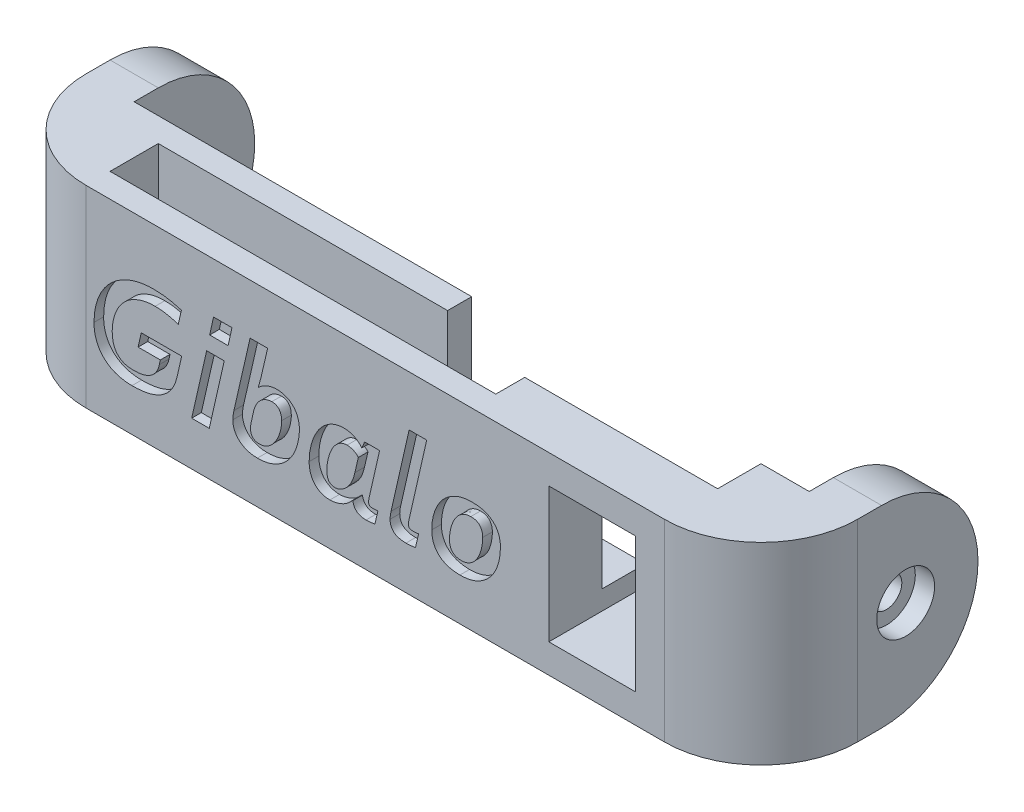
from build123d import *

# Parameters (mm, degrees)
SKETCH1_W           = 70
SKETCH1_H           = 10
BOSS_EXTRUDE1_DEPTH = 20
FILLET1_R           = 10
FILLET2_R           = 10
SKETCH4_R           = 1.6
CUT_EXTRUDE2_DEPTH  = 94
SKETCH5_R           = 3
CUT_EXTRUDE3_DEPTH  = 2
CUT_EXTRUDE4_START  = -2
SKETCH6_R           = 3
CUT_EXTRUDE4_DEPTH  = 2
CUT_EXTRUDE5_DEPTH  = 15
CUT_EXTRUDE7_DEPTH  = 1
SKETCH10_W          = 9
SKETCH10_H          = 14
CUT_EXTRUDE8_DEPTH  = 16


with BuildPart() as part:
    # Sketch1 → Boss-Extrude1 (new body)
    with BuildSketch(Plane(origin=(0, 0, 0), x_dir=(1, 0, 0), z_dir=(0, 1, 0))):
        Polygon((-34.024767802, -4.690402477), (-34.024767802, 5.309597523), (-34.024767802, 17.809597523), (-39.024767802, 17.809597523), (-39.024767802, -4.690402477), align=None)
        with Locations((0.975232198, 0.309597523)):
            Rectangle(SKETCH1_W, SKETCH1_H)
        Polygon((35.975232198, 17.809597523), (35.975232198, 5.309597523), (35.975232198, -4.690402477), (40.975232198, -4.690402477), (40.975232198, 17.809597523), align=None)
    extrude(amount=BOSS_EXTRUDE1_DEPTH)

    # Fillet1
    fillet1_edges = [part.edges().sort_by_distance(p)[0] for p in [
        (40.975232198, 10, 4.690402477),
        (-39.024767802, 10, 4.690402477),
    ]]
    fillet(fillet1_edges, radius=FILLET1_R)

    # Fillet2
    fillet2_edges = [part.edges().sort_by_distance(p)[0] for p in [
        (-36.524767802, 0, -17.809597523),
        (38.475232198, 0, -17.809597523),
        (38.475232198, 20, -17.809597523),
        (-36.524767802, 20, -17.809597523),
    ]]
    fillet(fillet2_edges, radius=FILLET2_R - 0.0001)  # a hair under: the kernel refuses the full size

    # Sketch4 → Cut-Extrude2 (cut)
    with BuildSketch(Plane(origin=(40.975232198, 0, 0), x_dir=(0, 0, -1), z_dir=(1, 0, 0))):
        with Locations((10.309597523, 10)):
            Circle(SKETCH4_R)
    extrude(amount=-CUT_EXTRUDE2_DEPTH, mode=Mode.SUBTRACT)

    # Sketch5 → Cut-Extrude3 (cut)
    with BuildSketch(Plane.ZY.offset(39.024767802)):
        with Locations((-10.309597523, 10)):
            Circle(SKETCH5_R)
    extrude(amount=-CUT_EXTRUDE3_DEPTH, mode=Mode.SUBTRACT)

    # Sketch6 → Cut-Extrude4 (cut)
    with BuildSketch(Plane(origin=(40.975232198, 0, 0), x_dir=(0, 0, -1), z_dir=(1, 0, 0)).offset(CUT_EXTRUDE4_START)):
        with Locations(Location((10.309597523, 10, 0), (0, 0, 180))):
            Circle(SKETCH6_R)
    extrude(amount=CUT_EXTRUDE4_DEPTH, mode=Mode.SUBTRACT)

    # Sketch7 → Cut-Extrude5 (cut)
    with BuildSketch(Plane(origin=(0, 20, 0), x_dir=(1, 0, 0), z_dir=(0, 1, 0))):
        Polygon((0.975232198, 2.809597523), (-29.024767802, 2.809597523), (-29.024767802, -2.190402477), (10.975232198, -2.190402477), (10.975232198, 0.809597523), (30.975232198, 0.809597523), (30.975232198, 5.309597523), (0.975232198, 5.309597523), align=None)
    extrude(amount=-CUT_EXTRUDE5_DEPTH, mode=Mode.SUBTRACT)

    # Sketch9 → Cut-Extrude7 (cut)
    # profile 1 of 7: a face of its own
    with BuildSketch(Plane.XY.offset(4.690402477)):
        with BuildLine():
            add(Edge.make_bspline(
                [(-21.97503532, 14.185374159), (-21.841839767, 14.183870266), (-21.577998515, 14.180891271), (-21.187421598, 14.154039466), (-20.805975821, 14.116646277), (-20.436911935, 14.055726848), (-20.081776238, 13.988084032), (-19.744866959, 13.910604742), (-19.428398913, 13.826075799), (-19.226767867, 13.759660684), (-19.128753729, 13.727375873)],
                knots=[0, 0, 0, 0, 1.103935331, 2.186737251, 3.24413943, 4.27965227, 5.286007376, 6.240597236, 7.144743092, 8, 8, 8, 8], degree=3))
            Line((-19.128753729, 13.727375873), (-19.452907768, 12.301098102))
            add(Edge.make_bspline(
                [(-19.452907768, 12.301098102), (-19.559322482, 12.336037479), (-19.768277926, 12.404644276), (-20.080819621, 12.492565948), (-20.385047736, 12.565649475), (-20.777096315, 12.643448807), (-21.261682763, 12.711620627), (-21.649927348, 12.720976086), (-21.843282388, 12.725635327)],
                knots=[0, 0, 0, 0, 0.826647237, 1.623200706, 2.395726174, 3.135406251, 4.573364156, 6, 6, 6, 6], degree=3))
            add(Edge.make_bspline(
                [(-21.843282388, 12.725635327), (-21.964656905, 12.72383746), (-22.203702309, 12.720296587), (-22.555917706, 12.686012821), (-22.895421629, 12.629648714), (-23.221450977, 12.551910142), (-23.532443943, 12.457494258), (-23.824993512, 12.340324953), (-24.100854584, 12.210576458), (-24.357108439, 12.060403901), (-24.596581258, 11.89658639), (-24.820922416, 11.719118053), (-25.028703119, 11.525543998), (-25.220398616, 11.318939821), (-25.396677952, 11.101054923), (-25.555512265, 10.872899146), (-25.698314811, 10.63515264), (-25.825824306, 10.389400393), (-25.935640205, 10.134836444), (-26.036040326, 9.87560572), (-26.115416325, 9.607679332), (-26.208670588, 9.246280193), (-26.284937966, 8.78590874), (-26.296306929, 8.414349351), (-26.301968907, 8.229305113)],
                knots=[0, 0, 0, 0, 1.125655505, 2.216962681, 3.279004566, 4.315782685, 5.324180779, 6.29084783, 7.23667735, 8.149478511, 9.042714482, 9.926395845, 10.800346389, 11.674296933, 12.538794144, 13.398075675, 14.250909206, 15.109898696, 15.964128529, 16.821656322, 17.686951297, 18.55427363, 20.283957211, 22, 22, 22, 22], degree=3))
            add(Edge.make_bspline(
                [(-26.301968907, 8.229305113), (-26.30073708, 8.133716909), (-26.298348921, 7.94839883), (-26.269353582, 7.680312669), (-26.229216438, 7.42956926), (-26.169164485, 7.196720527), (-26.088834278, 6.983152781), (-25.995128711, 6.785759307), (-25.881646622, 6.607780069), (-25.75153409, 6.446512281), (-25.601017358, 6.306342252), (-25.43599476, 6.181596823), (-25.251813325, 6.078960925), (-25.050881599, 5.995405295), (-24.833427654, 5.927652671), (-24.597505665, 5.883918067), (-24.345342517, 5.852467871), (-24.171026104, 5.850436359), (-24.080990913, 5.849387074)],
                knots=[0, 0, 0, 0, 1.229197895, 2.383061741, 3.465272405, 4.494181844, 5.470381682, 6.396955037, 7.300098202, 8.17973572, 9.05524884, 9.93953742, 10.835033703, 11.759477851, 12.735348058, 13.759006526, 14.842517054, 16, 16, 16, 16], degree=3))
            add(Edge.make_bspline(
                [(-24.080990913, 5.849387074), (-23.997312345, 5.850624955), (-23.832526741, 5.853062676), (-23.589318629, 5.871348131), (-23.355129716, 5.906184688), (-23.128900697, 5.948315537), (-22.913563807, 6.007076274), (-22.709204589, 6.079430654), (-22.519260916, 6.170643261), (-22.339369535, 6.272520043), (-22.173564589, 6.392796511), (-22.019976699, 6.528643372), (-21.882120548, 6.682844085), (-21.755244733, 6.851539824), (-21.641714843, 7.036885961), (-21.548485139, 7.242692558), (-21.467343317, 7.463765412), (-21.431026142, 7.620251332), (-21.412471214, 7.70020207)],
                knots=[0, 0, 0, 0, 1.127770514, 2.22088344, 3.28382356, 4.317503795, 5.320323511, 6.289163694, 7.234766033, 8.156544892, 9.071788957, 9.990114012, 10.914713456, 11.854228665, 12.832272572, 13.836895091, 14.894840947, 16, 16, 16, 16], degree=3))
            Line((-21.412471214, 7.70020207), (-21.312088028, 8.172839571))
            Line((-21.312088028, 8.172839571), (-23.616718677, 8.172839571))
            Line((-23.616718677, 8.172839571), (-23.292564639, 9.620030505))
            Line((-23.292564639, 9.620030505), (-19.097383983, 9.620030505))
            Line((-19.097383983, 9.620030505), (-19.576295434, 7.507800963))
            add(Edge.make_bspline(
                [(-19.576295434, 7.507800963), (-19.613362772, 7.362016884), (-19.685291254, 7.079125581), (-19.834035213, 6.679791854), (-20.014363107, 6.319382601), (-20.224462976, 5.997247317), (-20.461544627, 5.711777003), (-20.716720754, 5.454000112), (-20.997075111, 5.229938201), (-21.297346637, 5.034008778), (-21.618061502, 4.870133676), (-21.955206154, 4.730980062), (-22.309306528, 4.618337785), (-22.679448489, 4.531576206), (-23.061009659, 4.467139688), (-23.452237995, 4.425323698), (-23.851109481, 4.393023974), (-24.120657305, 4.390780313), (-24.256661489, 4.389648242)],
                knots=[0, 0, 0, 0, 1.171066271, 2.272432405, 3.311764285, 4.304254046, 5.260908622, 6.197756602, 7.124638, 8.050882979, 8.985872289, 9.925673948, 10.88903917, 11.876824032, 12.88465781, 13.901041654, 14.940940747, 16, 16, 16, 16], degree=3))
            add(Edge.make_bspline(
                [(-24.256661489, 4.389648242), (-24.396926001, 4.392110002), (-24.67266241, 4.396949406), (-25.0765234, 4.445394133), (-25.464458471, 4.517136018), (-25.833456334, 4.621255534), (-26.182350176, 4.755184079), (-26.508021178, 4.918177451), (-26.808306182, 5.111650304), (-27.084262773, 5.332504256), (-27.334845354, 5.581063197), (-27.552512552, 5.862485087), (-27.743799283, 6.169030922), (-27.906142343, 6.503459098), (-28.03340289, 6.866914483), (-28.124986723, 7.257283212), (-28.179846485, 7.674247199), (-28.186835403, 7.960750539), (-28.190427597, 8.108008763)],
                knots=[0, 0, 0, 0, 1.099310515, 2.161059335, 3.184816847, 4.190140034, 5.162577533, 6.111016273, 7.040427035, 7.958078671, 8.877941518, 9.800771385, 10.741111504, 11.706735398, 12.709395315, 13.754110347, 14.845647931, 16, 16, 16, 16], degree=3))
            add(Edge.make_bspline(
                [(-28.190427597, 8.108008763), (-28.187886608, 8.246806946), (-28.182834681, 8.522761797), (-28.146296127, 8.932676385), (-28.08783138, 9.334856404), (-28.007262112, 9.728561914), (-27.89951883, 10.110710914), (-27.772738283, 10.482214726), (-27.621550702, 10.839480997), (-27.450673105, 11.184160789), (-27.254098247, 11.5120534), (-27.042460543, 11.829550733), (-26.804245286, 12.128559487), (-26.547221344, 12.413571282), (-26.269567043, 12.681101635), (-25.97095455, 12.929029823), (-25.653335285, 13.156304657), (-25.317558354, 13.36436389), (-24.962572576, 13.550889344), (-24.589191949, 13.71633122), (-24.195647471, 13.855631533), (-23.785579739, 13.975777712), (-23.356613781, 14.06994447), (-22.910704134, 14.135166606), (-22.448575664, 14.179738151), (-22.134781515, 14.183472884), (-21.97503532, 14.185374159)],
                knots=[0, 0, 0, 0, 1.023740072, 2.035372753, 3.03309641, 4.020390265, 4.997251231, 5.959934282, 6.913995603, 7.856835973, 8.79515039, 9.732153554, 10.669340121, 11.612250598, 12.561421687, 13.510801681, 14.472591674, 15.440082999, 16.422234839, 17.428324357, 18.449750217, 19.499353084, 20.578578765, 21.68613438, 22.822058251, 24, 24, 24, 24], degree=3))
        make_face()
    # profile 2 of 7: a face of its own
    with BuildSketch(Plane.XY.offset(4.690402477)):
        Polygon((-16.19463685, 12.97241066), (-15.793104105, 14.78558196), (-13.881640935, 14.78558196), (-14.28317368, 12.97241066), align=None)
    # profile 3 of 7: a face of its own
    with BuildSketch(Plane.XY.offset(4.690402477)):
        Polygon((-18.062182376, 4.565318818), (-16.504151674, 11.403923376), (-14.682615108, 11.403923376), (-16.24064581, 4.565318818), align=None)
    # profile 4 of 7: a face of its own
    with BuildSketch(Plane.XY.offset(4.690402477)):
        with BuildLine():
            add(Edge.make_bspline(
                [(-10.872236666, 11.822186652), (-10.917790136, 11.644106317), (-11.006157743, 11.298654411), (-11.107537275, 10.956797481), (-11.156655694, 10.791167677)],
                knots=[0, 0, 0, 0, 1.030999291, 2, 2, 2, 2], degree=3))
            Line((-11.156655694, 10.791167677), (-11.125285948, 10.791167677))
            add(Edge.make_bspline(
                [(-11.125285948, 10.791167677), (-11.075443232, 10.841135174), (-10.972566058, 10.9442699), (-10.791444979, 11.08166194), (-10.588346037, 11.212365998), (-10.361132912, 11.332560056), (-10.110592494, 11.435801784), (-9.834849332, 11.512136629), (-9.538534491, 11.564532845), (-9.333261179, 11.570350094), (-9.228461993, 11.573320003)],
                knots=[0, 0, 0, 0, 0.80320757, 1.657849576, 2.583078345, 3.552904099, 4.582291314, 5.663349111, 6.807058219, 8, 8, 8, 8], degree=3))
            add(Edge.make_bspline(
                [(-9.228461993, 11.573320003), (-9.149638954, 11.57093035), (-8.994319071, 11.566221566), (-8.763452827, 11.54015028), (-8.540448662, 11.487727061), (-8.322192007, 11.423179955), (-8.115960401, 11.333755895), (-7.919631699, 11.231122848), (-7.740995325, 11.102964096), (-7.575120272, 10.958601646), (-7.423533188, 10.795605599), (-7.291764424, 10.610987164), (-7.173998516, 10.409753738), (-7.073609936, 10.189162843), (-6.991456969, 9.950040429), (-6.932972311, 9.691427327), (-6.900293077, 9.413829082), (-6.895123402, 9.222765089), (-6.892461598, 9.124388523)],
                knots=[0, 0, 0, 0, 0.992034587, 1.954792649, 2.91655148, 3.870883492, 4.814067566, 5.740132838, 6.652642756, 7.572582667, 8.503577047, 9.445659485, 10.420407327, 11.432971191, 12.489696427, 13.596064595, 14.762242398, 16, 16, 16, 16], degree=3))
            add(Edge.make_bspline(
                [(-6.892461598, 9.124388523), (-6.897588474, 8.947680804), (-6.908062146, 8.586685378), (-6.99902938, 8.043538321), (-7.136247956, 7.496175208), (-7.302133921, 7.049296636), (-7.4623203, 6.702115836), (-7.599719711, 6.448414674), (-7.753691432, 6.203461022), (-7.923296288, 5.966047375), (-8.108902398, 5.740830329), (-8.310153044, 5.528292997), (-8.529095221, 5.331430744), (-8.7626028, 5.147645867), (-9.012352547, 4.978420652), (-9.281442478, 4.831025652), (-9.565708234, 4.698268903), (-9.867753495, 4.587228672), (-10.187468927, 4.499500755), (-10.524943382, 4.434113703), (-10.881145189, 4.396682867), (-11.124502301, 4.392024925), (-11.248673614, 4.389648242)],
                knots=[0, 0, 0, 0, 1.472759177, 3.008693273, 4.580848206, 6.173729551, 6.974835018, 7.768225139, 8.577953803, 9.386220295, 10.199800618, 11.009883982, 11.824854739, 12.65290799, 13.486513861, 14.337454105, 15.208802548, 16.100850079, 17.017617301, 17.970785264, 18.964606969, 20, 20, 20, 20], degree=3))
            add(Edge.make_bspline(
                [(-11.248673614, 4.389648242), (-11.346346162, 4.391594861), (-11.536643607, 4.395387498), (-11.814658287, 4.426676924), (-12.075385793, 4.481242748), (-12.319968631, 4.553992644), (-12.545770852, 4.647185484), (-12.75652946, 4.75240767), (-12.946630265, 4.87770862), (-13.122009676, 5.012133039), (-13.27534678, 5.165321884), (-13.412727198, 5.329914819), (-13.527319375, 5.511477183), (-13.62412369, 5.703833126), (-13.698931883, 5.90681218), (-13.753505507, 6.117608386), (-13.788348605, 6.334807231), (-13.791981509, 6.482229146), (-13.793805647, 6.55625201)],
                knots=[0, 0, 0, 0, 1.250491143, 2.436357748, 3.576037707, 4.657605152, 5.698591998, 6.700616389, 7.668707818, 8.609754101, 9.525002799, 10.438203324, 11.349438519, 12.267599054, 13.191167577, 14.113484272, 15.052750757, 16, 16, 16, 16], degree=3))
            add(Edge.make_bspline(
                [(-13.793805647, 6.55625201), (-13.792370184, 6.618322881), (-13.789462175, 6.744068085), (-13.775405614, 6.904555811), (-13.755966959, 7.04313326), (-13.734341885, 7.1635187), (-13.709976085, 7.299742313), (-13.689544085, 7.39492958), (-13.678783246, 7.445061471)],
                knots=[0, 0, 0, 0, 1.244333274, 2.520811148, 3.226291687, 4.048702975, 4.972318327, 6, 6, 6, 6], degree=3))
            Line((-13.678783246, 7.445061471), (-12.005730143, 14.78558196))
            Line((-12.005730143, 14.78558196), (-10.184193578, 14.78558196))
            Line((-10.184193578, 14.78558196), (-10.872236666, 11.822186652))
        make_face()
        with BuildLine():
            add(Edge.make_bspline(
                [(-11.896981692, 7.240112466), (-11.910151005, 7.177496375), (-11.933040244, 7.06866498), (-11.955939824, 6.922769197), (-11.964892236, 6.806644696), (-11.965640435, 6.737510031), (-11.965995132, 6.704735473)],
                knots=[0, 0, 0, 0, 1.419193461, 2.466663119, 3.273093488, 4, 4, 4, 4], degree=3))
            add(Edge.make_bspline(
                [(-11.965995132, 6.704735473), (-11.963320417, 6.636187152), (-11.958215466, 6.50535611), (-11.915762954, 6.318845009), (-11.844574396, 6.153972407), (-11.745500922, 6.010364543), (-11.615819868, 5.894615464), (-11.454954558, 5.814203272), (-11.268142433, 5.766210874), (-11.134650917, 5.760411033), (-11.064637773, 5.757369154)],
                knots=[0, 0, 0, 0, 1.106449162, 2.111764306, 3.069993933, 3.991658481, 4.909116541, 5.845930511, 6.87024148, 8, 8, 8, 8], degree=3))
            add(Edge.make_bspline(
                [(-11.064637773, 5.757369154), (-11.002450729, 5.758511051), (-10.88013206, 5.760757102), (-10.701708119, 5.792343274), (-10.530735673, 5.83710977), (-10.315494803, 5.925624572), (-10.061488387, 6.072050895), (-9.789094428, 6.302073628), (-9.543454746, 6.573334725), (-9.330453192, 6.88309249), (-9.147386961, 7.218680925), (-8.997429876, 7.573051693), (-8.878556218, 7.936980957), (-8.793925695, 8.303769066), (-8.738839958, 8.661942447), (-8.73195952, 8.897649135), (-8.728637378, 9.011457439)],
                knots=[0, 0, 0, 0, 0.593425366, 1.167236712, 1.726322451, 2.279223644, 3.386329273, 4.512093459, 5.672136548, 6.873201344, 8.095358979, 9.318967893, 10.544913375, 11.748634989, 12.912953905, 14, 14, 14, 14], degree=3))
            add(Edge.make_bspline(
                [(-8.728637378, 9.011457439), (-8.731274915, 9.089772992), (-8.736452252, 9.243502039), (-8.782058153, 9.464899533), (-8.850283048, 9.670552115), (-8.9564154, 9.851173319), (-9.096672469, 10.005484159), (-9.246925237, 10.098811418), (-9.383055778, 10.154263977), (-9.497318914, 10.185817359), (-9.622582401, 10.201623978), (-9.708729953, 10.204242069), (-9.753382404, 10.205599091)],
                knots=[0, 0, 0, 0, 1.315784066, 2.582810458, 3.787998383, 4.944283209, 6.080901484, 7.261658167, 7.882207875, 8.550646753, 9.248763636, 10, 10, 10, 10], degree=3))
            add(Edge.make_bspline(
                [(-9.753382404, 10.205599091), (-9.841680608, 10.200319859), (-10.026775064, 10.189253308), (-10.25512524, 10.123234434), (-10.44109555, 10.050959481), (-10.580622961, 9.97882149), (-10.715940213, 9.890636071), (-10.848132083, 9.788481101), (-10.972974683, 9.66988259), (-11.096028428, 9.540391817), (-11.209987493, 9.393077095), (-11.319355048, 9.232742006), (-11.418234509, 9.055135122), (-11.506579048, 8.86056691), (-11.579203501, 8.646555698), (-11.616447564, 8.496597378), (-11.635567144, 8.419614904)],
                knots=[0, 0, 0, 0, 1.323624627, 2.774638316, 3.539762985, 4.316167742, 5.125469977, 5.960117866, 6.818408992, 7.706261799, 8.637226509, 9.608886798, 10.615485335, 11.682625625, 12.810354677, 14, 14, 14, 14], degree=3))
            Line((-11.635567144, 8.419614904), (-11.896981692, 7.240112466))
        make_face(mode=Mode.SUBTRACT)
    # profile 5 of 7: a face of its own
    with BuildSketch(Plane.XY.offset(4.690402477)):
        with BuildLine():
            add(Edge.make_bspline(
                [(0.282844897, 6.209093492), (0.283753374, 6.179698008), (0.285467977, 6.124218839), (0.305894446, 6.047052206), (0.342802631, 5.984189828), (0.410807304, 5.915412535), (0.539192525, 5.868425023), (0.647886746, 5.861527694), (0.707382122, 5.85775234)],
                knots=[0, 0, 0, 0, 0.836637905, 1.579017247, 2.246934084, 2.893221951, 4.299459483, 6, 6, 6, 6], degree=3))
            add(Edge.make_bspline(
                [(0.707382122, 5.85775234), (0.790425491, 5.860047116), (0.973026122, 5.865093005), (1.154352941, 5.887410664), (1.253215697, 5.899578668)],
                knots=[0, 0, 0, 0, 0.909562782, 2, 2, 2, 2], degree=3))
            Line((1.253215697, 5.899578668), (0.937426923, 4.559044869))
            add(Edge.make_bspline(
                [(0.937426923, 4.559044869), (0.781654439, 4.532211309), (0.477771267, 4.479864021), (0.169559466, 4.471233438), (0.019339033, 4.467026948)],
                knots=[0, 0, 0, 0, 1.025212973, 2, 2, 2, 2], degree=3))
            add(Edge.make_bspline(
                [(0.019339033, 4.467026948), (-0.079941988, 4.469560888), (-0.267523541, 4.474348514), (-0.529103849, 4.527352105), (-0.75551244, 4.609647376), (-0.943722508, 4.731031124), (-1.094821821, 4.885546987), (-1.21376598, 5.067673995), (-1.30309901, 5.278092271), (-1.335646007, 5.431072166), (-1.352564511, 5.510593821)],
                knots=[0, 0, 0, 0, 1.246503269, 2.355143187, 3.339908273, 4.258822686, 5.145057094, 6.037165818, 6.979684067, 8, 8, 8, 8], degree=3))
            Line((-1.352564511, 5.510593821), (-1.383934257, 5.510593821))
            add(Edge.make_bspline(
                [(-1.383934257, 5.510593821), (-1.471849684, 5.415806422), (-1.643299828, 5.230954757), (-1.92767224, 4.995133849), (-2.219516688, 4.797487447), (-2.521584579, 4.64436316), (-2.827681102, 4.533457119), (-3.130131695, 4.449833267), (-3.430395557, 4.400258469), (-3.629837668, 4.393155095), (-3.728299917, 4.389648242)],
                knots=[0, 0, 0, 0, 1.157170378, 2.256680472, 3.301176131, 4.309474979, 5.28167368, 6.213411489, 7.117982044, 8, 8, 8, 8], degree=3))
            add(Edge.make_bspline(
                [(-3.728299917, 4.389648242), (-3.809954589, 4.391586323), (-3.969018433, 4.395361716), (-4.201940095, 4.426897015), (-4.421388161, 4.482150236), (-4.629755013, 4.554099916), (-4.822382712, 4.649423462), (-5.001179921, 4.760569727), (-5.165866562, 4.888216469), (-5.312601892, 5.035694951), (-5.4428718, 5.200420639), (-5.557890848, 5.38041229), (-5.657005605, 5.576478828), (-5.737662911, 5.788362142), (-5.803462955, 6.013279147), (-5.845055066, 6.252594677), (-5.877013286, 6.50241756), (-5.879168326, 6.673951524), (-5.880264471, 6.761201016)],
                knots=[0, 0, 0, 0, 1.08352716, 2.110718132, 3.111568652, 4.083122159, 5.030721548, 5.957540227, 6.87372175, 7.789669641, 8.711579828, 9.656102588, 10.620226043, 11.621974283, 12.661591404, 13.725021968, 14.842849126, 16, 16, 16, 16], degree=3))
            add(Edge.make_bspline(
                [(-5.880264471, 6.761201016), (-5.874595344, 6.952449924), (-5.8631711, 7.337848674), (-5.783872379, 7.912640356), (-5.656131086, 8.47816497), (-5.473684303, 9.023164346), (-5.241602092, 9.540396014), (-5.007997641, 9.945926894), (-4.796196275, 10.248274524), (-4.624907696, 10.459264456), (-4.441920672, 10.655042557), (-4.24748187, 10.835364181), (-4.040651303, 10.99860115), (-3.821437672, 11.143520776), (-3.592148093, 11.271828458), (-3.349470457, 11.378105757), (-3.098079265, 11.467788273), (-2.833266717, 11.527076767), (-2.559053228, 11.566554863), (-2.371875697, 11.571043206), (-2.27692635, 11.573320003)],
                knots=[0, 0, 0, 0, 1.549684503, 3.122875191, 4.693426295, 6.242327983, 7.772165508, 9.28085894, 10.026925728, 10.761894363, 11.481348501, 12.196955084, 12.908984731, 13.614077688, 14.324671518, 15.035377625, 15.758967672, 16.483901761, 17.230930457, 18, 18, 18, 18], degree=3))
            add(Edge.make_bspline(
                [(-2.27692635, 11.573320003), (-2.189673875, 11.5708386), (-2.015750279, 11.565892329), (-1.758792058, 11.528329812), (-1.509211146, 11.461609017), (-1.266586297, 11.372774583), (-1.034267127, 11.256030448), (-0.81601256, 11.109922655), (-0.613659127, 10.933288377), (-0.494937959, 10.796168268), (-0.434476621, 10.726336869)],
                knots=[0, 0, 0, 0, 0.997741803, 1.988835756, 2.961544552, 3.947881021, 4.939103237, 5.927531961, 6.944550552, 8, 8, 8, 8], degree=3))
            Line((-0.434476621, 10.726336869), (-0.403106875, 10.726336869))
            Line((-0.403106875, 10.726336869), (-0.133327062, 11.403923376))
            Line((-0.133327062, 11.403923376), (1.42470364, 11.403923376))
            Line((1.42470364, 11.403923376), (0.343493072, 6.639904666))
            add(Edge.make_bspline(
                [(0.343493072, 6.639904666), (0.335076918, 6.596699558), (0.318816991, 6.513227711), (0.29679275, 6.395815414), (0.286850771, 6.294997304), (0.284048129, 6.234896162), (0.282844897, 6.209093492)],
                knots=[0, 0, 0, 0, 1.212599506, 2.342730416, 3.288499711, 4, 4, 4, 4], degree=3))
        make_face()
        with BuildLine():
            add(Edge.make_bspline(
                [(-0.78163514, 9.676496047), (-0.807421184, 9.707827067), (-0.862714706, 9.775010789), (-0.965366535, 9.866762659), (-1.08578724, 9.957203766), (-1.226918058, 10.03687147), (-1.386438864, 10.101940768), (-1.558836221, 10.159403358), (-1.747455256, 10.199397092), (-1.87866551, 10.203485482), (-1.946498363, 10.205599091)],
                knots=[0, 0, 0, 0, 0.736359573, 1.578990301, 2.493472908, 3.469066101, 4.513512228, 5.618995236, 6.769072233, 8, 8, 8, 8], degree=3))
            add(Edge.make_bspline(
                [(-1.946498363, 10.205599091), (-2.005873255, 10.203522557), (-2.121881745, 10.199465361), (-2.292075485, 10.16948194), (-2.453472191, 10.11903069), (-2.606868946, 10.049446154), (-2.751738942, 9.962471695), (-2.889474773, 9.862223819), (-3.019644789, 9.74884993), (-3.182196403, 9.579821461), (-3.366408923, 9.339595421), (-3.549260432, 9.016006433), (-3.701226111, 8.667508528), (-3.829098834, 8.308531035), (-3.923749461, 7.944827064), (-3.992938957, 7.588636879), (-4.033441429, 7.248005205), (-4.040645409, 7.027586003), (-4.04408869, 6.922232377)],
                knots=[0, 0, 0, 0, 0.667396305, 1.303979425, 1.936156066, 2.564091009, 3.193198933, 3.832862932, 4.477311322, 5.131411362, 6.467147199, 7.868098498, 9.299825973, 10.737655272, 12.148352057, 13.521106702, 14.81516494, 16, 16, 16, 16], degree=3))
            add(Edge.make_bspline(
                [(-4.04408869, 6.922232377), (-4.042353934, 6.828618963), (-4.039111721, 6.653658057), (-3.998625515, 6.411458216), (-3.939142744, 6.206082801), (-3.848122857, 6.039818199), (-3.730118032, 5.911628841), (-3.587028226, 5.821874438), (-3.421587235, 5.764532289), (-3.302865641, 5.759822498), (-3.241023201, 5.757369154)],
                knots=[0, 0, 0, 0, 1.397252255, 2.611426183, 3.65913237, 4.577822536, 5.418040818, 6.232952999, 7.07953983, 8, 8, 8, 8], degree=3))
            add(Edge.make_bspline(
                [(-3.241023201, 5.757369154), (-3.175217489, 5.7600539), (-3.042014424, 5.765488327), (-2.843755489, 5.815004458), (-2.64522972, 5.890565691), (-2.449769424, 5.997879649), (-2.260074319, 6.132418975), (-2.078513569, 6.289053271), (-1.90710898, 6.468048007), (-1.805809004, 6.601207603), (-1.754097256, 6.669183095)],
                knots=[0, 0, 0, 0, 0.872401808, 1.76590436, 2.697517127, 3.687309041, 4.71697306, 5.780077864, 6.866771136, 8, 8, 8, 8], degree=3))
            add(Edge.make_bspline(
                [(-1.754097256, 6.669183095), (-1.686561815, 6.767977237), (-1.547663554, 6.9711644), (-1.384722494, 7.319166913), (-1.242672659, 7.709614845), (-1.173476468, 7.99008352), (-1.137158924, 8.137287193)],
                knots=[0, 0, 0, 0, 0.894383925, 1.839454525, 2.866040106, 4, 4, 4, 4], degree=3))
            Line((-1.137158924, 8.137287193), (-0.78163514, 9.676496047))
        make_face(mode=Mode.SUBTRACT)
    # profile 6 of 7: a face of its own
    with BuildSketch(Plane.XY.offset(4.690402477)):
        with BuildLine():
            Line((4.488482134, 14.78558196), (6.307927384, 14.78558196))
            Line((6.307927384, 14.78558196), (4.465477654, 6.675457044))
            add(Edge.make_bspline(
                [(4.465477654, 6.675457044), (4.456015102, 6.631612055), (4.438644637, 6.551125533), (4.420197029, 6.438679034), (4.406042633, 6.346069088), (4.403741043, 6.28999319), (4.402738163, 6.265559034)],
                knots=[0, 0, 0, 0, 1.295997848, 2.379071419, 3.293706875, 4, 4, 4, 4], degree=3))
            add(Edge.make_bspline(
                [(4.402738163, 6.265559034), (4.404002727, 6.234630161), (4.406380612, 6.17647154), (4.433038235, 6.096767442), (4.47253705, 6.028008907), (4.534528366, 5.977709528), (4.610849948, 5.939058177), (4.702603953, 5.91379869), (4.809903982, 5.896476269), (4.88644427, 5.894414766), (4.927658574, 5.893304718)],
                knots=[0, 0, 0, 0, 1.006221832, 1.892098561, 2.720173339, 3.560065027, 4.45641898, 5.501331371, 6.654553161, 8, 8, 8, 8], degree=3))
            add(Edge.make_bspline(
                [(4.927658574, 5.893304718), (5.017798057, 5.89609918), (5.201778873, 5.901802866), (5.383099161, 5.933568081), (5.475583465, 5.949770261)],
                knots=[0, 0, 0, 0, 0.979879146, 2, 2, 2, 2], degree=3))
            Line((5.475583465, 5.949770261), (5.143064161, 4.550679603))
            add(Edge.make_bspline(
                [(5.143064161, 4.550679603), (5.07622287, 4.538992611), (4.925643875, 4.512664339), (4.683555851, 4.483627371), (4.421232451, 4.462017322), (4.243143076, 4.459764506), (4.15596283, 4.458661683)],
                knots=[0, 0, 0, 0, 0.820141219, 1.847601066, 2.946334286, 4, 4, 4, 4], degree=3))
            add(Edge.make_bspline(
                [(4.15596283, 4.458661683), (4.090428135, 4.460256221), (3.962684683, 4.463364374), (3.777200461, 4.476107313), (3.604493361, 4.505326709), (3.443272462, 4.537988124), (3.29617257, 4.588633123), (3.158994601, 4.642299028), (3.037687098, 4.714049296), (2.924738146, 4.789467525), (2.829163683, 4.881194874), (2.74388007, 4.979918699), (2.672651129, 5.089828729), (2.613579686, 5.208919408), (2.570507136, 5.338821282), (2.535931422, 5.476964768), (2.517891737, 5.625836976), (2.515502527, 5.728050042), (2.514279473, 5.780373634)],
                knots=[0, 0, 0, 0, 1.308481378, 2.550556285, 3.705664751, 4.802759121, 5.827888189, 6.807145062, 7.735566105, 8.634862485, 9.510935339, 10.369601036, 11.233996103, 12.117549373, 13.015122136, 13.959973027, 14.955695742, 16, 16, 16, 16], degree=3))
            add(Edge.make_bspline(
                [(2.514279473, 5.780373634), (2.515562038, 5.838977201), (2.51820957, 5.959949546), (2.538320083, 6.146364819), (2.569611983, 6.343937777), (2.599295253, 6.478316944), (2.614662659, 6.547886745)],
                knots=[0, 0, 0, 0, 0.906536012, 1.871315922, 2.897953231, 4, 4, 4, 4], degree=3))
            Line((2.614662659, 6.547886745), (4.488482134, 14.78558196))
        make_face()
    # profile 7 of 7: a face of its own
    with BuildSketch(Plane.XY.offset(4.690402477)):
        with BuildLine():
            add(Edge.make_bspline(
                [(11.038485032, 11.573320003), (11.146588251, 11.571148315), (11.357625538, 11.566908782), (11.666241564, 11.538662954), (11.958135804, 11.48531077), (12.234440106, 11.41473026), (12.494290754, 11.326109589), (12.73474239, 11.214611802), (12.954940633, 11.082019936), (13.157727074, 10.931699442), (13.337656904, 10.758644499), (13.500132071, 10.567203923), (13.634210386, 10.349983528), (13.750549757, 10.114528104), (13.842991644, 9.858761864), (13.906655712, 9.582113005), (13.947779531, 9.285959213), (13.951740087, 9.081312898), (13.953780064, 8.97590506)],
                knots=[0, 0, 0, 0, 1.169669153, 2.283408447, 3.348613956, 4.376697366, 5.366583206, 6.31478931, 7.23834747, 8.143426999, 9.039663949, 9.933899268, 10.852516597, 11.793616776, 12.77179613, 13.787129265, 14.860209527, 16, 16, 16, 16], degree=3))
            add(Edge.make_bspline(
                [(13.953780064, 8.97590506), (13.950568653, 8.826594113), (13.944202457, 8.530604952), (13.893081147, 8.091147543), (13.805990248, 7.661702727), (13.690946644, 7.242632947), (13.540636363, 6.840457768), (13.35626842, 6.461052742), (13.139649327, 6.104971061), (12.891024195, 5.774391694), (12.610570792, 5.471471706), (12.295268894, 5.202131508), (11.949179606, 4.962409961), (11.570140393, 4.757804173), (11.160444238, 4.589744155), (10.717312228, 4.474713699), (10.244152613, 4.401229576), (9.917826102, 4.393577916), (9.750234143, 4.389648242)],
                knots=[0, 0, 0, 0, 1.026074801, 2.034057279, 3.03574541, 4.035495028, 5.0179998, 5.982309011, 6.930593797, 7.878333713, 8.820814675, 9.761991553, 10.7229142, 11.709115572, 12.717200535, 13.758554929, 14.848857946, 16, 16, 16, 16], degree=3))
            add(Edge.make_bspline(
                [(9.750234143, 4.389648242), (9.643511092, 4.391749819), (9.434535195, 4.395864945), (9.127650021, 4.425392693), (8.835239165, 4.474798095), (8.558031012, 4.545693893), (8.29842877, 4.637625601), (8.056793187, 4.748676411), (7.83341998, 4.877881401), (7.631424441, 5.02961718), (7.449820621, 5.201360783), (7.293278238, 5.396543435), (7.152614855, 5.608482479), (7.038601607, 5.844550026), (6.945621985, 6.099943114), (6.881871818, 6.377361635), (6.840972816, 6.674927516), (6.836990134, 6.880959647), (6.834939111, 6.987063184)],
                knots=[0, 0, 0, 0, 1.154380546, 2.260408698, 3.331541505, 4.35943624, 5.351636664, 6.30651211, 7.232545098, 8.137458525, 9.033530996, 9.928619277, 10.838452366, 11.779379832, 12.757379669, 13.772526469, 14.852883666, 16, 16, 16, 16], degree=3))
            add(Edge.make_bspline(
                [(6.834939111, 6.987063184), (6.838148078, 7.136374551), (6.84450943, 7.432364542), (6.895666505, 7.871815822), (6.982489563, 8.30062512), (7.098024048, 8.719844079), (7.250175103, 9.121543954), (7.434411664, 9.501979766), (7.650789183, 9.857060033), (7.89815833, 10.18738233), (8.179042453, 10.489849087), (8.49398354, 10.760671352), (8.842013553, 10.997445014), (9.218818719, 11.20393436), (9.629290736, 11.370806061), (10.071833598, 11.488420587), (10.545280647, 11.561743012), (10.870901358, 11.56938631), (11.038485032, 11.573320003)],
                knots=[0, 0, 0, 0, 1.026343489, 2.034589917, 3.03654035, 4.031935777, 5.020872116, 5.985433841, 6.933966944, 7.875243875, 8.817971635, 9.766153544, 10.724611634, 11.706859358, 12.715208299, 13.762706599, 14.848556508, 16, 16, 16, 16], degree=3))
        make_face()
        with BuildLine():
            add(Edge.make_bspline(
                [(10.88372762, 10.205599091), (10.823006107, 10.203993162), (10.703814325, 10.200840843), (10.528883076, 10.175976715), (10.362748803, 10.13063342), (10.151645401, 10.053575109), (9.904549323, 9.91871715), (9.641862451, 9.704148982), (9.411464886, 9.446476386), (9.213147741, 9.153039753), (9.049730518, 8.828696176), (8.912405726, 8.484938901), (8.803363131, 8.125350746), (8.72771113, 7.757754771), (8.679303318, 7.389189024), (8.673827601, 7.144056132), (8.671114891, 7.022615563)],
                knots=[0, 0, 0, 0, 0.594782995, 1.167514481, 1.725771235, 2.278908185, 3.366816593, 4.464328711, 5.586176444, 6.741632674, 7.923666515, 9.137317155, 10.364477529, 11.599404698, 12.810728106, 14, 14, 14, 14], degree=3))
            add(Edge.make_bspline(
                [(8.671114891, 7.022615563), (8.674243914, 6.929546269), (8.680214309, 6.751963495), (8.738434943, 6.501127039), (8.829024022, 6.279361264), (8.961485331, 6.090458437), (9.134705803, 5.935812398), (9.356403806, 5.832867092), (9.616708806, 5.766276149), (9.804827776, 5.760463887), (9.904991555, 5.757369154)],
                knots=[0, 0, 0, 0, 1.104585046, 2.107626126, 3.043343293, 3.935332683, 4.827860738, 5.769138119, 6.812179568, 8, 8, 8, 8], degree=3))
            add(Edge.make_bspline(
                [(9.904991555, 5.757369154), (9.96573192, 5.758904717), (10.084960709, 5.761918912), (10.259450927, 5.787755466), (10.425765181, 5.829213207), (10.636211838, 5.908730561), (10.883456852, 6.043588205), (11.146821195, 6.2594786), (11.379106116, 6.515349441), (11.577293823, 6.809383096), (11.74636142, 7.130611493), (11.881010897, 7.476449017), (11.985086489, 7.838043571), (12.058233094, 8.209038365), (12.109849989, 8.579913022), (12.115050466, 8.827254895), (12.117604283, 8.948717948)],
                knots=[0, 0, 0, 0, 0.593382766, 1.164765937, 1.719997156, 2.265443797, 3.360032946, 4.454961319, 5.578741844, 6.725846461, 7.911379214, 9.119658864, 10.346600529, 11.583921751, 12.81352787, 14, 14, 14, 14], degree=3))
            add(Edge.make_bspline(
                [(12.117604283, 8.948717948), (12.114369272, 9.040365808), (12.108176012, 9.215820809), (12.05085903, 9.464523057), (11.956894714, 9.684233647), (11.823131274, 9.872144329), (11.649357934, 10.026726638), (11.429640347, 10.132905295), (11.169523332, 10.195828574), (10.983109125, 10.202201529), (10.88372762, 10.205599091)],
                knots=[0, 0, 0, 0, 1.093353071, 2.093166853, 3.029083226, 3.930240682, 4.827117997, 5.776676631, 6.814697509, 8, 8, 8, 8], degree=3))
        make_face(mode=Mode.SUBTRACT)
    extrude(amount=-CUT_EXTRUDE7_DEPTH, mode=Mode.SUBTRACT)

    # Sketch10 → Cut-Extrude8 (cut)
    with BuildSketch(Plane.XY.offset(4.690402477)):
        with Locations((23.475232198, 10)):
            Rectangle(SKETCH10_W, SKETCH10_H)
    extrude(amount=-CUT_EXTRUDE8_DEPTH, mode=Mode.SUBTRACT)


solid = part.part
